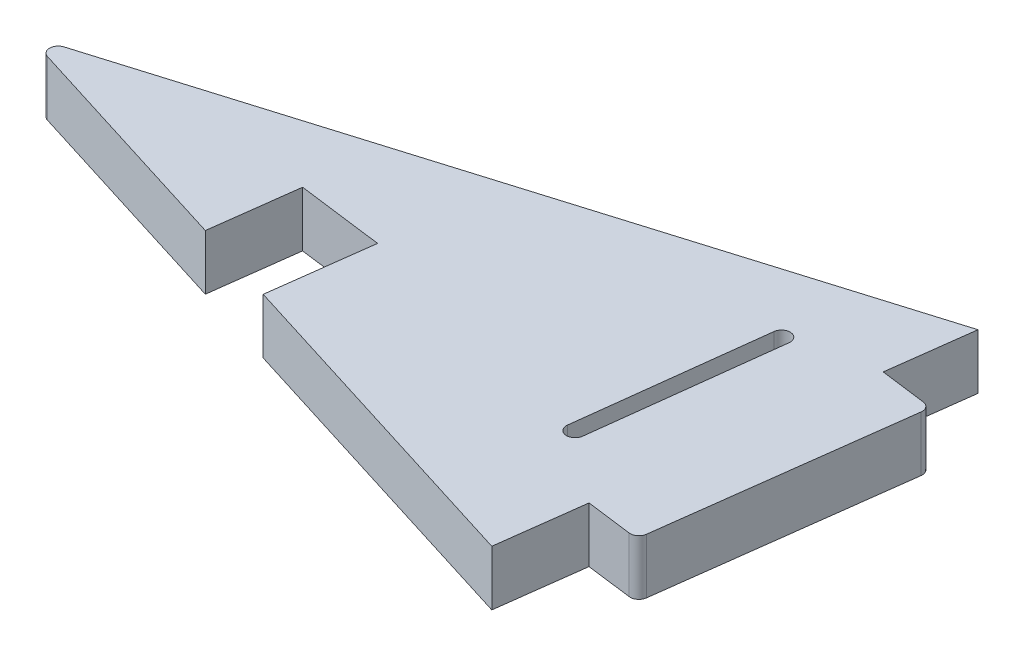
from build123d import *

# Parameters (mm, degrees)
BOSS_EXTRUDE1_DEPTH = 6.35
FILLET1_R           = 1


with BuildPart() as part:
    # Sketch1 → Boss-Extrude1 (new body)
    with BuildSketch(Plane(origin=(0, 0, 0), x_dir=(1, 0, 0), z_dir=(0, 1, 0))):
        Polygon((-2.58662904, -0.182978259), (-1.306630871, 9.734763655), (4.991135245, 8.921964817), (8.862776708, 38.921964817), (2.565209371, 39.734738), (3.813361808, 49.405731314), (-80.122978657, 24.047130996), (-50.562245366, 14.809401842), (-49.282247196, 24.727143757), (-39.364505281, 23.447145587), (-40.870201664, 11.780638185), align=None)
        with BuildLine():
            Line((-5.765677194, 37.231163577), (-8.327046549, 16.028717249))
            ThreePointArc((-8.327046549, 16.028717249), (-9.439761879, 15.155868697), (-10.312610431, 16.268584027))
            Line((-10.312610431, 16.268584027), (-7.751241076, 37.471030354))
            ThreePointArc((-7.751241076, 37.471030354), (-6.638525747, 38.343878906), (-5.765677194, 37.231163577))
        make_face(mode=Mode.SUBTRACT)
    extrude(amount=BOSS_EXTRUDE1_DEPTH)

    # Fillet1
    fillet1_edges = [part.edges().sort_by_distance(p)[0] for p in [
        (4.991135245, 3.175, -8.921964817),
        (8.862776708, 3.175, -38.921964817),
        (-80.122978657, 3.175, -24.047130996),
    ]]
    fillet(fillet1_edges, radius=FILLET1_R)


solid = part.part
